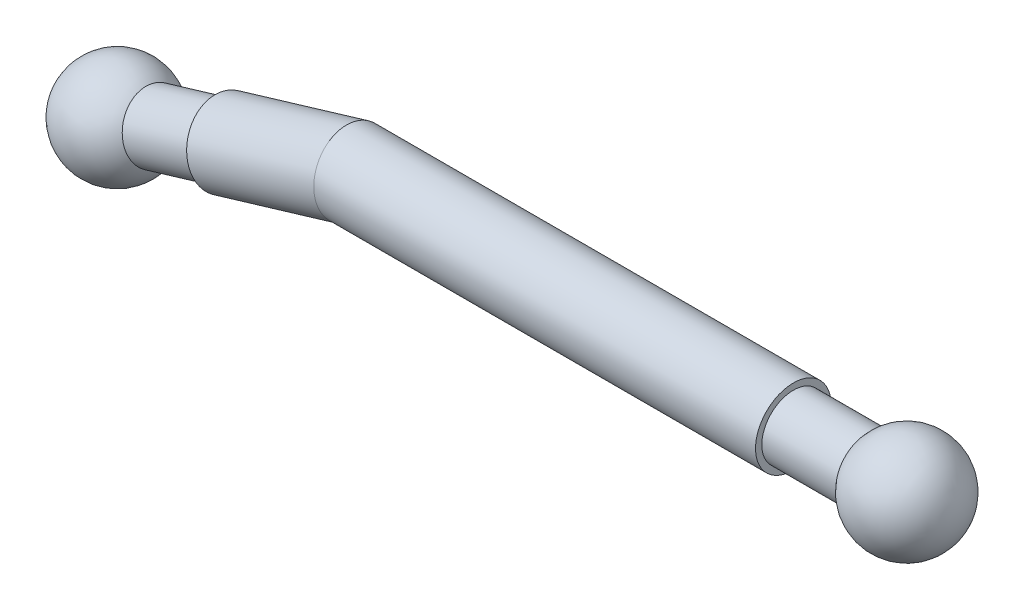
from build123d import *

# Parameters (mm, degrees)
SKETCH1_R           = 3
SKETCH3_R           = 2.5
BOSS_EXTRUDE1_DEPTH = 6
SKETCH5_R           = 2.5
BOSS_EXTRUDE2_DEPTH = 6


with BuildPart() as part:
    # Sweep2: sweep along a path in Sketch2
    with BuildLine(Plane.XY) as sweep2_path:
        Line((0, 0), (-35, 0))
        Line((-35, 0), (-45, -3))
    # Sketch1 → Sweep2 (sweep)
    with BuildSketch(Plane(origin=(0, 0, 0), x_dir=(0, 0, -1), z_dir=(1, 0, 0))):
        Circle(SKETCH1_R)
    sweep(path=sweep2_path.line, transition=Transition.RIGHT)

    # Sketch3 → Boss-Extrude1 (add)
    with BuildSketch(Plane(origin=(-42.110091743, -12.633027523, 0), x_dir=(0, 0, 1), z_dir=(-0.9578262852211515, -0.2873478855663453, 0))):
        with Locations((0, 10.057175995)):
            Circle(SKETCH3_R)
    extrude(amount=BOSS_EXTRUDE1_DEPTH)

    # Sketch4 → Revolve1 (revolve)
    with BuildSketch(Plane(origin=(-50.73052831, -15.219158493, 0), x_dir=(0, 0, 1), z_dir=(-0.9578262852211515, -0.28734788556634533, 0))):
        with BuildLine():
            Line((0, 14.057175995), (0, 6.057175995))
            ThreePointArc((0, 6.057175995), (4, 10.057175995), (0, 14.057175995))
        make_face()
    revolve(axis=Axis((-54.769828109, -1.754825829, 0), (0.28734788556634544, -0.9578262852211514, 0)))

    # Sketch5 → Boss-Extrude2 (add)
    with BuildSketch(Plane(origin=(0, 0, 0), x_dir=(0, 0, -1), z_dir=(1, 0, 0))):
        Circle(SKETCH5_R)
    extrude(amount=BOSS_EXTRUDE2_DEPTH)

    # Sketch6 → Revolve2 (revolve)
    with BuildSketch(Plane(origin=(9, 0, 0), x_dir=(0, 0, -1), z_dir=(1, 0, 0))):
        with BuildLine():
            Line((0, 4), (0, -4))
            ThreePointArc((0, -4), (4, 0), (0, 4))
        make_face()
    revolve(axis=Axis((9, 4, 0), (0, -1, 0)))


solid = part.part
